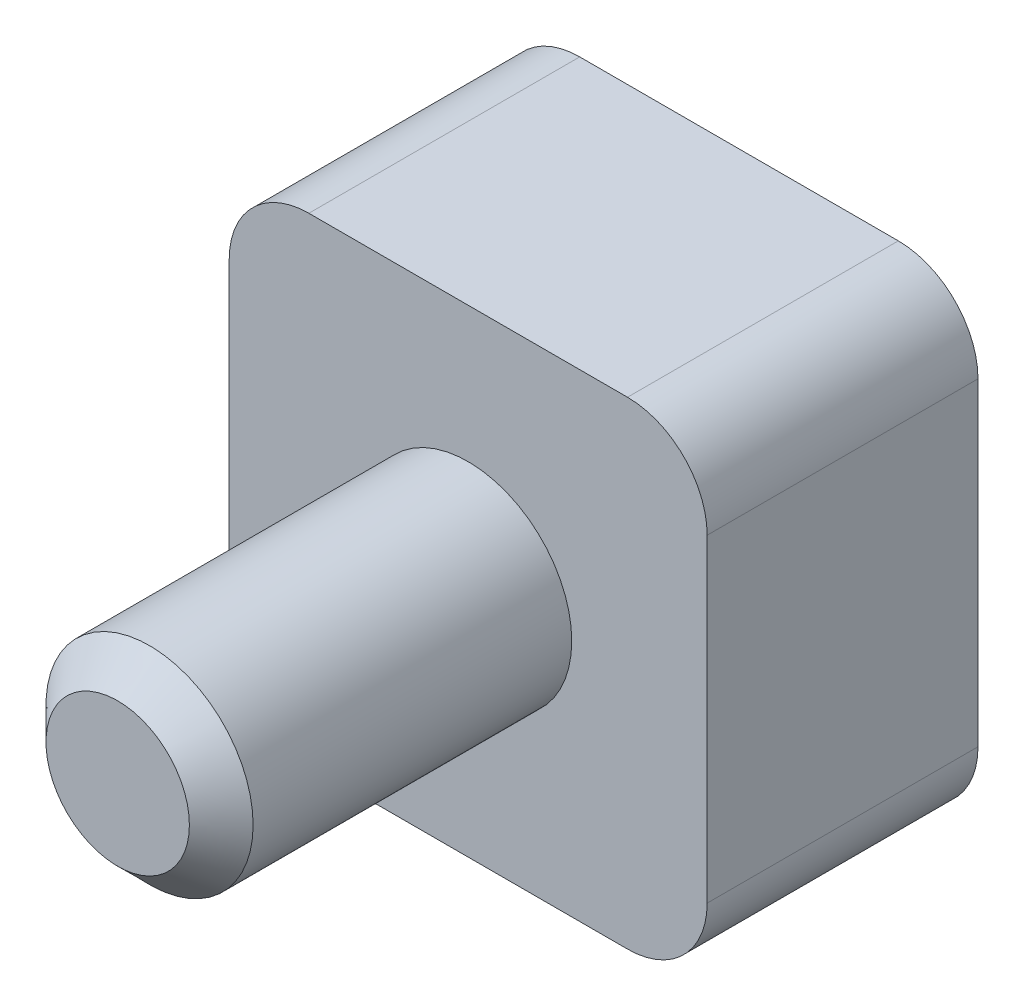
from build123d import *

# Parameters (mm, degrees)
BOSS_EXTRUDE1_DEPTH = 3
FILLET1_R           = 1.5
BOSS_EXTRUDE2_DEPTH = 5.5
SKETCH4_R           = 3.25
BOSS_EXTRUDE3_DEPTH = 11
CHAMFER1_SIZE       = 1


with BuildPart() as part:
    # Sketch1 → Boss-Extrude1 (new body)
    with BuildSketch(Plane.XY):
        with BuildLine():
            Line((5, -7.5), (-5, -7.5))
            ThreePointArc((-5, -7.5), (-6.767766953, -6.767766953), (-7.5, -5))
            Line((-7.5, -5), (-7.5, 5))
            ThreePointArc((-7.5, 5), (-6.767766953, 6.767766953), (-5, 7.5))
            Line((-5, 7.5), (5, 7.5))
            ThreePointArc((5, 7.5), (6.767766953, 6.767766953), (7.5, 5))
            Line((7.5, 5), (7.5, -5))
            ThreePointArc((7.5, -5), (6.767766953, -6.767766953), (5, -7.5))
        make_face()
        with BuildLine():
            Line((3.25, 5), (3.25, 6.5))
            Line((3.25, 6.5), (-5, 6.5))
            ThreePointArc((-5, 6.5), (-6.060660172, 6.060660172), (-6.5, 5))
            Line((-6.5, 5), (-6.5, -3.25))
            Line((-6.5, -3.25), (-5, -3.25))
            ThreePointArc((-5, -3.25), (-3.762563133, -3.762563133), (-3.25, -5))
            Line((-3.25, -5), (-3.25, -6.5))
            Line((-3.25, -6.5), (5, -6.5))
            ThreePointArc((5, -6.5), (6.060660172, -6.060660172), (6.5, -5))
            Line((6.5, -5), (6.5, 3.25))
            Line((6.5, 3.25), (5, 3.25))
            ThreePointArc((5, 3.25), (3.762563133, 3.762563133), (3.25, 5))
        make_face(mode=Mode.SUBTRACT)
    extrude(amount=BOSS_EXTRUDE1_DEPTH)

    # Fillet1
    fillet1_edges = [part.edges().sort_by_distance(p)[0] for p in [
        (-6.5, -3.25, 1.5),
        (-3.25, -6.5, 1.5),
        (6.5, 3.25, 1.5),
        (3.25, 6.5, 1.5),
    ]]
    fillet(fillet1_edges, radius=FILLET1_R - 0.0001)  # a hair under: the kernel refuses the full size

    # Sketch3 → Boss-Extrude2 (add)
    with BuildSketch(Plane.XY.offset(3)):
        with BuildLine():
            Line((-5, -7.5), (5, -7.5))
            ThreePointArc((5, -7.5), (6.767766953, -6.767766953), (7.5, -5))
            Line((7.5, -5), (7.5, 5))
            ThreePointArc((7.5, 5), (6.767766953, 6.767766953), (5, 7.5))
            Line((5, 7.5), (-5, 7.5))
            ThreePointArc((-5, 7.5), (-6.767766953, 6.767766953), (-7.5, 5))
            Line((-7.5, 5), (-7.5, -5))
            ThreePointArc((-7.5, -5), (-6.767766953, -6.767766953), (-5, -7.5))
        make_face()
    extrude(amount=BOSS_EXTRUDE2_DEPTH)

    # Sketch4 → Boss-Extrude3 (add)
    with BuildSketch(Plane.XY.offset(8.5)):
        Circle(SKETCH4_R)
    extrude(amount=BOSS_EXTRUDE3_DEPTH)

    # Chamfer1
    chamfer1_edges = [part.edges().sort_by_distance(p)[0] for p in [
        (-3.25, 0, 19.5),
    ]]
    chamfer(chamfer1_edges, length=CHAMFER1_SIZE)


solid = part.part
